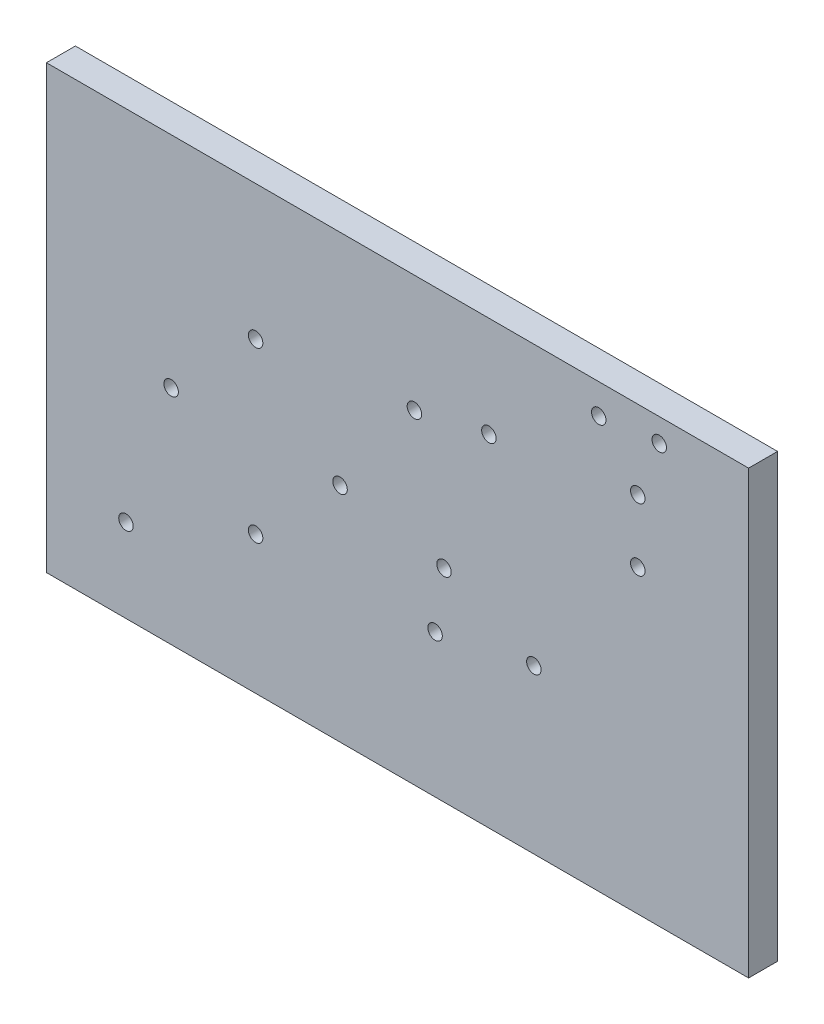
from build123d import *

# Parameters (mm, degrees)
BOSS_EXTRUDE1_DEPTH     = 12.7
CUT_EXTRUDE1_DEPTH      = 188.996466057
CUT_EXTRUDE1_DEPTH_BACK = 188.996466057
SKETCH3_R               = 3.175


with BuildPart() as part:
    # Sketch1 → Boss-Extrude1 (new body)
    with BuildSketch(Plane.XY):
        Polygon((155.575, -88.9), (-152.4, -88.9), (-152.4, 0), (-152.4, 104.775), (155.575, 104.775), (155.575, 0), align=None)
    extrude(amount=BOSS_EXTRUDE1_DEPTH)

    # Sketch3 → Cut-Extrude1 (cut, two sides: drawn at the far end of the back side and taken through both)
    with BuildSketch(Plane.XY.offset(12.7).offset(-CUT_EXTRUDE1_DEPTH_BACK)):
        with Locations((106.975954286, 70.395873002)):
            Circle(SKETCH3_R)
        with Locations((106.975954286, 42.900373002)):
            Circle(SKETCH3_R)
        with Locations((-60.663402782, 45.677048092)):
            Circle(SKETCH3_R)
        with Locations((-23.619846283, 8.633491593)):
            Circle(SKETCH3_R)
        with Locations((-60.663402782, -28.410064907)):
            Circle(SKETCH3_R)
        with Locations((-97.706959282, 8.633491593)):
            Circle(SKETCH3_R)
        with Locations((-117.518879062, -52.287624978)):
            Circle(SKETCH3_R)
        with Locations((8.985545702, 53.468225166)):
            Circle(SKETCH3_R)
        with Locations((41.65587457, 60.657920909)):
            Circle(SKETCH3_R)
        with Locations((18.062330035, -26.179653161)):
            Circle(SKETCH3_R)
        with Locations((21.976192961, 0)):
            Circle(SKETCH3_R)
        with Locations((61.383342435, -17.37389998)):
            Circle(SKETCH3_R)
        with Locations((89.842754417, 91.683154931)):
            Circle(SKETCH3_R)
        with Locations((116.371246163, 94.499523115)):
            Circle(SKETCH3_R)
    extrude(amount=CUT_EXTRUDE1_DEPTH + CUT_EXTRUDE1_DEPTH_BACK, mode=Mode.SUBTRACT)


solid = part.part
